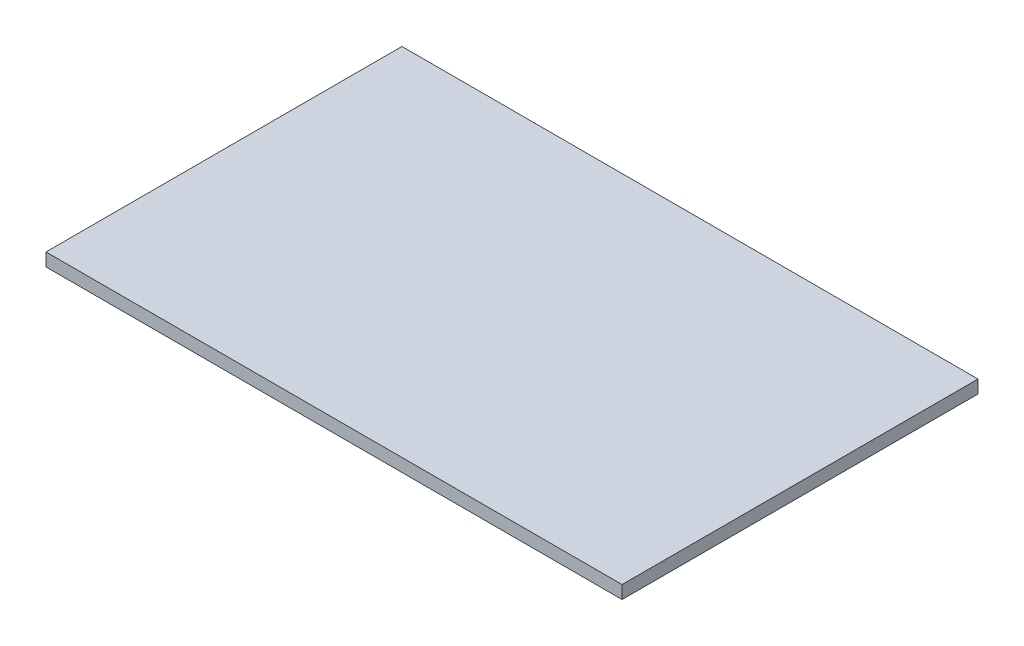
from build123d import *

# Parameters (mm, degrees)
SKETCH1_W           = 89.0016
SKETCH1_H           = 54.991
BOSS_EXTRUDE1_DEPTH = 2.0066


with BuildPart() as part:
    # Sketch1 → Boss-Extrude1 (new body)
    with BuildSketch(Plane(origin=(0, 0, 0), x_dir=(1, 0, 0), z_dir=(0, 1, 0))):
        Rectangle(SKETCH1_W, SKETCH1_H)
    extrude(amount=BOSS_EXTRUDE1_DEPTH)


solid = part.part
